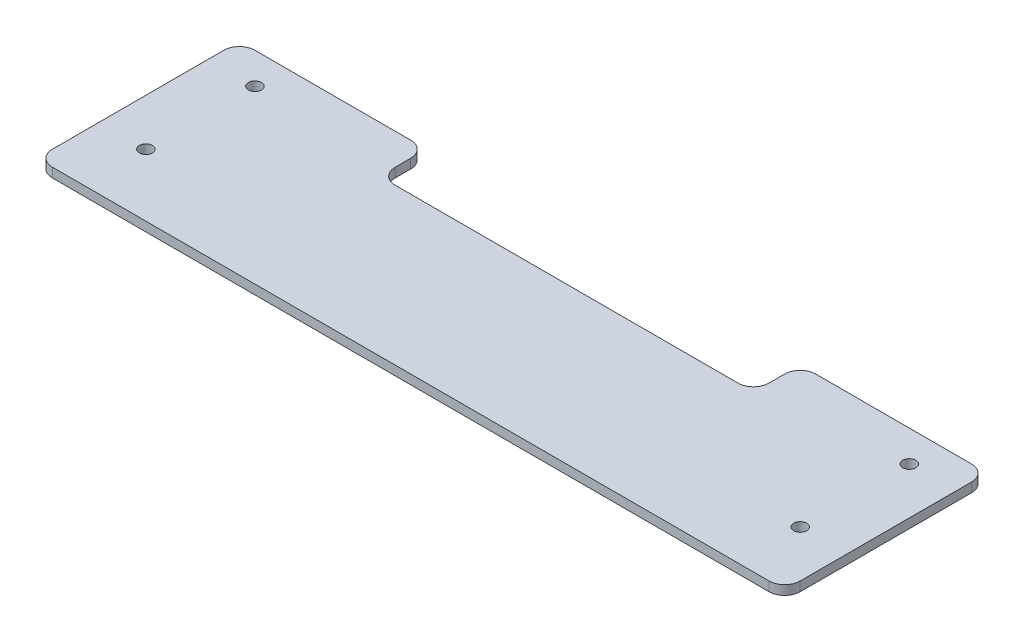
from build123d import *

# Parameters (mm, degrees)
SKETCH_1_R          = 2.1
EXTRUDE_1_DEPTH     = 3
SKETCH_2_W          = 120
SKETCH_2_H          = 15
CUT_EXTRUDE_1_DEPTH = 3
FILLET_1_R          = 5


with BuildPart() as part:
    # 草图1 → 凸台-拉伸1 (new body)
    with BuildSketch(Plane(origin=(0, 0, 0), x_dir=(1, 0, 0), z_dir=(0, 1, 0))):
        Polygon((-120, 57.5), (-120, -7.5), (-60, -7.5), (20, -7.5), (120, -7.5), (120, 57.5), align=None)
        with Locations((-105, 12.5)):
            Circle(SKETCH_1_R, mode=Mode.SUBTRACT)
        with Locations((105, 12.5)):
            Circle(SKETCH_1_R, mode=Mode.SUBTRACT)
        with Locations((-105, 47.5)):
            Circle(SKETCH_1_R, mode=Mode.SUBTRACT)
        with Locations((105, 47.5)):
            Circle(SKETCH_1_R, mode=Mode.SUBTRACT)
    extrude(amount=EXTRUDE_1_DEPTH)

    # 草图2 → 切除-拉伸1 (cut)
    with BuildSketch(Plane(origin=(0, 3, 0), x_dir=(1, 0, 0), z_dir=(0, 1, 0))):
        with Locations((0, 50)):
            Rectangle(SKETCH_2_W, SKETCH_2_H)
    extrude(amount=-CUT_EXTRUDE_1_DEPTH, mode=Mode.SUBTRACT)

    # 圆角1
    fillet_1_edges = [part.edges().sort_by_distance(p)[0] for p in [
        (120, 1.5, 7.5),
        (-120, 1.5, 7.5),
        (-120, 1.5, -57.5),
        (120, 1.5, -57.5),
        (60, 1.5, -57.5),
        (60, 1.5, -42.5),
        (-60, 1.5, -42.5),
        (-60, 1.5, -57.5),
    ]]
    fillet(fillet_1_edges, radius=FILLET_1_R)


solid = part.part
